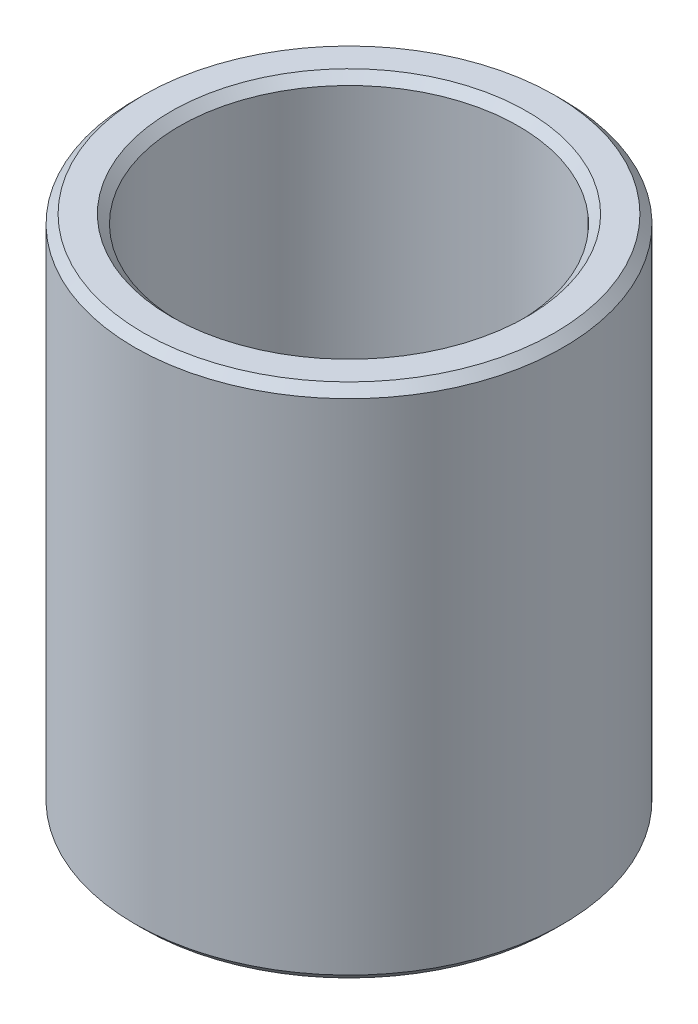
from build123d import *

# Parameters (mm, degrees)
SKETCH1_R           = 35
BOSS_EXTRUDE1_DEPTH = 84.325977639
SKETCH2_R           = 27.67590371
CUT_EXTRUDE1_DEPTH  = 98.779703951
CHAMFER1_SIZE       = 1.390129359


with BuildPart() as part:
    # Sketch1 → Boss-Extrude1 (new body)
    with BuildSketch(Plane(origin=(0, 0, 0), x_dir=(1, 0, 0), z_dir=(0, 1, 0))):
        Circle(SKETCH1_R)
    extrude(amount=BOSS_EXTRUDE1_DEPTH)

    # Sketch2 → Cut-Extrude1 (cut, through all)
    with BuildSketch(Plane(origin=(0, 0, 0), x_dir=(1, 0, 0), z_dir=(0, 1, 0))):
        Circle(SKETCH2_R)
    extrude(amount=CUT_EXTRUDE1_DEPTH, mode=Mode.SUBTRACT)

    # Chamfer1
    chamfer1_edges = [part.edges().sort_by_distance(p)[0] for p in [
        (-27.67590371, 84.325977639, 0),
        (-27.67590371, 0, 0),
        (-35, 0, 0),
        (-35, 84.325977639, 0),
    ]]
    chamfer(chamfer1_edges, length=CHAMFER1_SIZE)


solid = part.part
